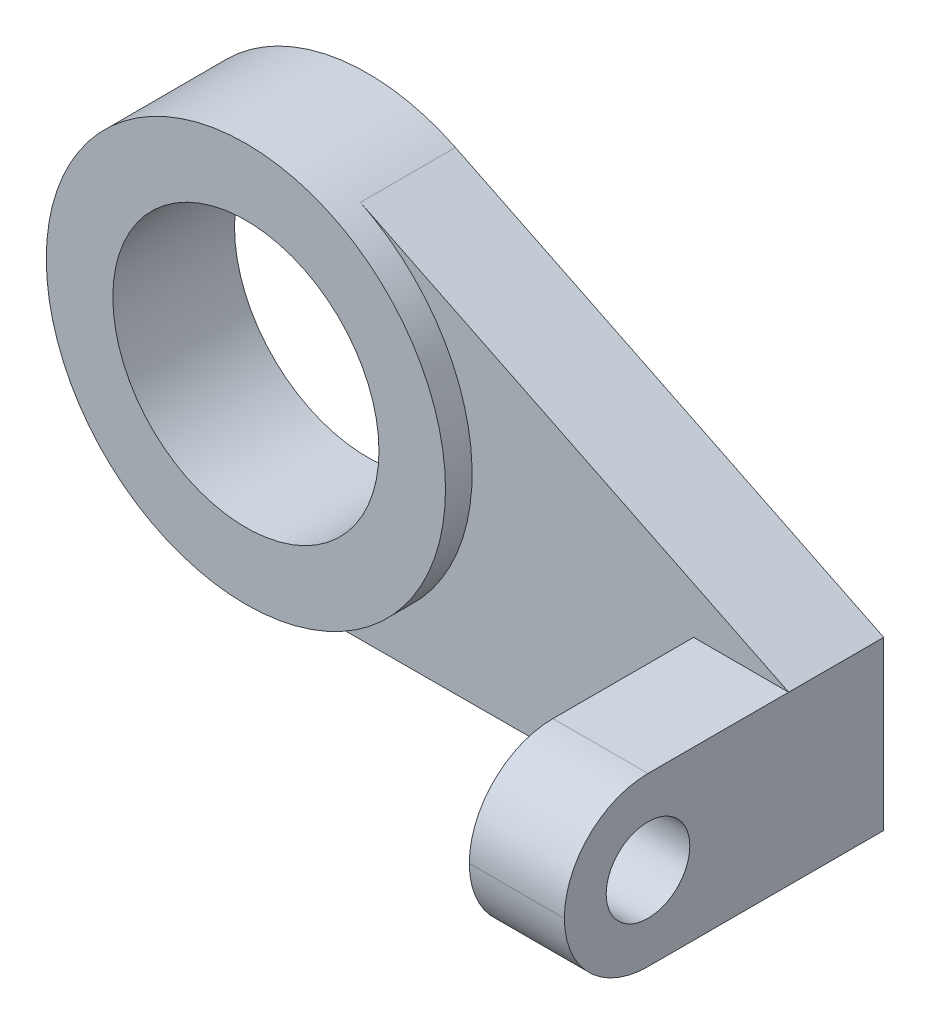
from build123d import *

# Parameters (mm, degrees)
SKETCH_1_R          = 52.5
SKETCH_1_R_2        = 35
EXTRUDE_1_DEPTH     = 32
EXTRUDE_3_DEPTH     = 25
SKETCH_3_W          = 25
SKETCH_3_H          = 44
EXTRUDE_4_DEPTH     = 59
FILLET_1_R          = 22
SKETCH_4_R          = 11
CUT_EXTRUDE_1_DEPTH = 59


with BuildPart() as part:
    # 스케치1 → 보스-돌출1 (new body)
    with BuildSketch(Plane.XY):
        Circle(SKETCH_1_R)
        Circle(SKETCH_1_R_2, mode=Mode.SUBTRACT)
    extrude(amount=EXTRUDE_1_DEPTH)

    # 스케치2 → 보스-돌출3 (add)
    with BuildSketch(Plane(origin=(0, 0, 0), x_dir=(-1, 0, 0), z_dir=(0, 0, -1))):
        with BuildLine():
            Line((-23.122008196, 47.134093149), (-135.758979711, -8.120878455))
            Line((-135.758979711, -8.120878455), (-135.758979711, -52.120878455))
            Line((-135.758979711, -52.120878455), (-0.146690573, -52.499795065))
            ThreePointArc((-0.146690573, -52.499795065), (-51.157462855, -11.796778977), (-23.122008196, 47.134093149))
        make_face()
    extrude(amount=-EXTRUDE_3_DEPTH)

    # 스케치3 → 보스-돌출4 (add)
    with BuildSketch(Plane.XY.offset(25)):
        with Locations((123.258979711, -30.120878455)):
            Rectangle(SKETCH_3_W, SKETCH_3_H)
    extrude(amount=EXTRUDE_4_DEPTH)

    # 필렛1
    fillet_1_edges = [part.edges().sort_by_distance(p)[0] for p in [
        (123.258979711, -8.120878455, 84),
        (123.258979711, -52.120878455, 84),
    ]]
    fillet(fillet_1_edges, radius=FILLET_1_R - 0.0001)  # a hair under: the kernel refuses the full size

    # 스케치4 → 컷-돌출1 (cut)
    with BuildSketch(Plane.ZY.offset(-110.758979711)):
        with Locations((62, -30.120878455)):
            Circle(SKETCH_4_R)
    extrude(amount=-CUT_EXTRUDE_1_DEPTH, mode=Mode.SUBTRACT)


solid = part.part
